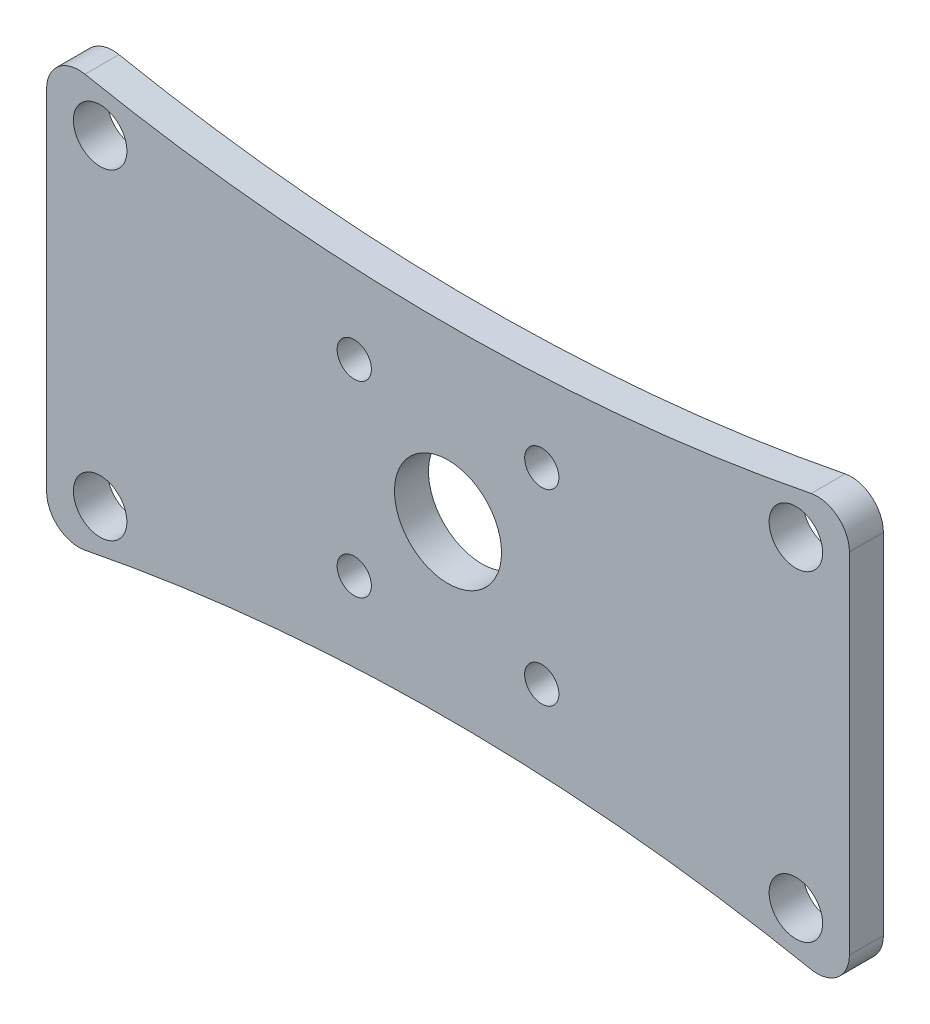
from build123d import *

# Parameters (mm, degrees)
SKETCH1_W           = 75
SKETCH1_H           = 40
SKETCH1_R           = 2.5
SKETCH1_R_2         = 1.6
BOSS_EXTRUDE1_DEPTH = 3.175
SKETCH2_R           = 175
CUT_EXTRUDE1_DEPTH  = 3.175
FILLET1_R           = 3
SKETCH3_R           = 5
CUT_EXTRUDE2_DEPTH  = 3.175


with BuildPart() as part:
    # Sketch1 → Boss-Extrude1 (new body)
    with BuildSketch(Plane.XY):
        Rectangle(SKETCH1_W, SKETCH1_H)
        with Locations((-32.5, 15)):
            Circle(SKETCH1_R, mode=Mode.SUBTRACT)
        with Locations((32.5, 15)):
            Circle(SKETCH1_R, mode=Mode.SUBTRACT)
        with Locations((32.5, -15)):
            Circle(SKETCH1_R, mode=Mode.SUBTRACT)
        with Locations((-32.5, -15)):
            Circle(SKETCH1_R, mode=Mode.SUBTRACT)
        with Locations((-8.76, 8.76)):
            Circle(SKETCH1_R_2, mode=Mode.SUBTRACT)
        with Locations((8.76, 8.76)):
            Circle(SKETCH1_R_2, mode=Mode.SUBTRACT)
        with Locations((8.76, -8.76)):
            Circle(SKETCH1_R_2, mode=Mode.SUBTRACT)
        with Locations((-8.76, -8.76)):
            Circle(SKETCH1_R_2, mode=Mode.SUBTRACT)
    extrude(amount=BOSS_EXTRUDE1_DEPTH)

    # Sketch2 → Cut-Extrude1 (cut)
    with BuildSketch(Plane.XY.offset(3.175)):
        with Locations((0, 190.93492914)):
            Circle(SKETCH2_R)
        with Locations((0, -190.93492914)):
            Circle(SKETCH2_R)
    extrude(amount=-CUT_EXTRUDE1_DEPTH, mode=Mode.SUBTRACT)

    # Fillet1
    fillet1_edges = [part.edges().sort_by_distance(p)[0] for p in [
        (37.5, 20, 1.5875),
        (37.5, -20, 1.5875),
        (-37.5, -20, 1.5875),
        (-37.5, 20, 1.5875),
    ]]
    fillet(fillet1_edges, radius=FILLET1_R)

    # Sketch3 → Cut-Extrude2 (cut)
    with BuildSketch(Plane.XY.offset(3.175)):
        Circle(SKETCH3_R)
    extrude(amount=-CUT_EXTRUDE2_DEPTH, mode=Mode.SUBTRACT)


solid = part.part
